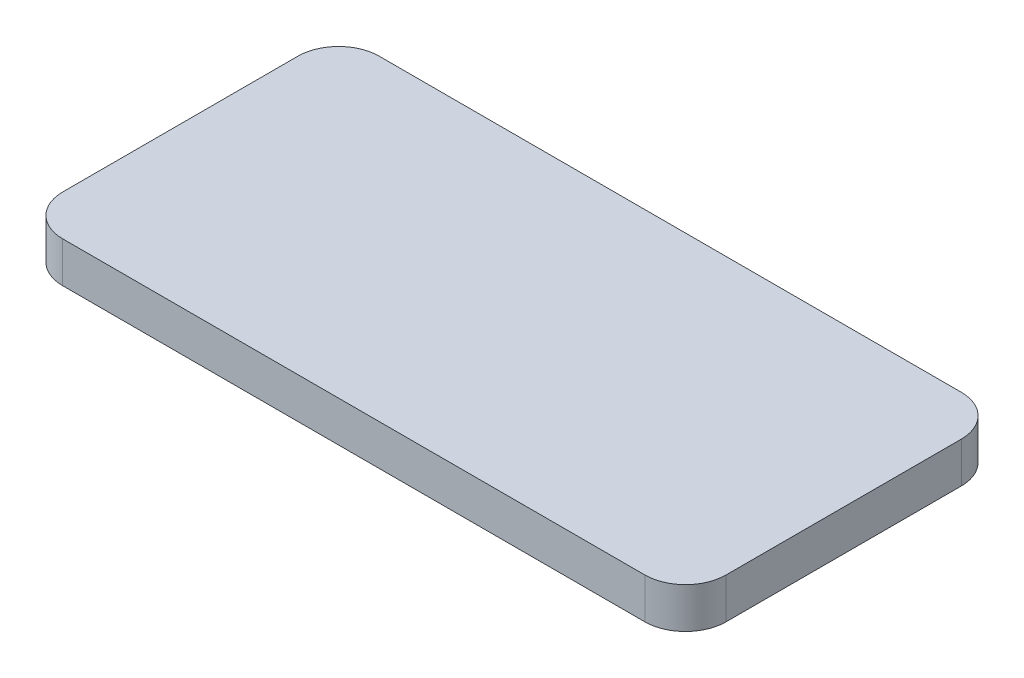
from build123d import *

# Parameters (mm, degrees)
EXTRUDE_1_DEPTH = 10


with BuildPart() as part:
    # 草图1 → 凸台-拉伸1 (new body)
    with BuildSketch(Plane(origin=(0, 0, 0), x_dir=(1, 0, 0), z_dir=(0, 1, 0))):
        with BuildLine():
            Line((10, 0), (153.3, 0))
            ThreePointArc((153.3, 0), (160.371067812, 2.928932188), (163.3, 10))
            Line((163.3, 10), (163.3, 67.9))
            ThreePointArc((163.3, 67.9), (160.371067812, 74.971067812), (153.3, 77.9))
            Line((153.3, 77.9), (10, 77.9))
            ThreePointArc((10, 77.9), (2.928932188, 74.971067812), (0, 67.9))
            Line((0, 67.9), (0, 10))
            ThreePointArc((0, 10), (2.928932188, 2.928932188), (10, 0))
        make_face()
    extrude(amount=EXTRUDE_1_DEPTH)


solid = part.part
